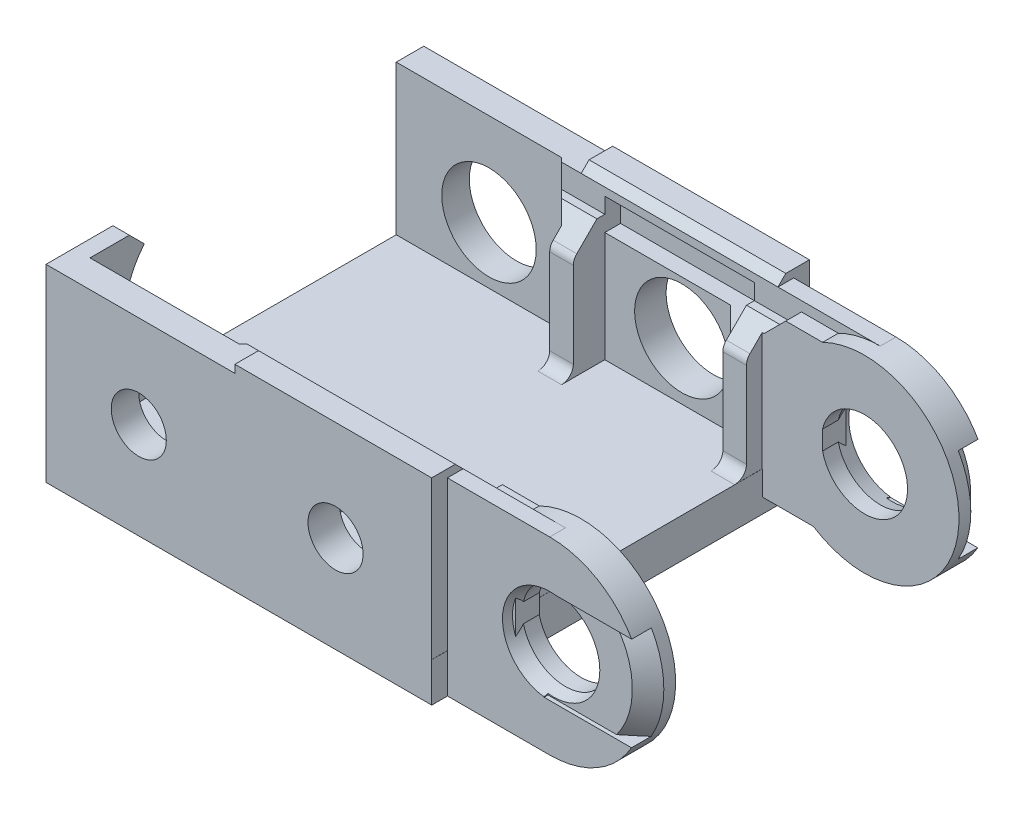
from build123d import *

# Parameters (mm, degrees)
SKETCH_1_W             = 25
SKETCH_1_H             = 25
EXTRUDE_1_DEPTH        = 4
SKETCH_2_W             = 24
SKETCH_2_H             = 24
EXTRUDE_2_DEPTH        = 3.5
EXTRUDE_4_DEPTH        = 2
SKETCH_6_R             = 5
CUT_EXTRUDE_2_DEPTH    = 10
EXTRUDE_6_DEPTH        = 20
SKETCH_9_W             = 19
SKETCH_9_H             = 3
CUT_EXTRUDE_4_DEPTH    = 2
CHAMFER_2_SIZE         = 1
CHAMFER_3_SIZE         = 3.732050808
CHAMFER_3_SIZE_2       = 1
CHAMFER_4_SIZE         = 1
SKETCH_11_W            = 3
SKETCH_11_H            = 4
EXTRUDE_7_DEPTH        = 16
PATTERN_LINEAR_1_COUNT = 2
PATTERN_LINEAR_1_PITCH = 22
CHAMFER_6_SIZE         = 3
FILLET_2_R             = 1.5
SKETCH_13_R            = 3.5
CUT_EXTRUDE_6_DEPTH    = 10
PATTERN_LINEAR_2_COUNT = 2
PATTERN_LINEAR_2_PITCH = 25
CHAMFER_7_SIZE         = 3
EXTRUDE_START          = 2
SKETCH_16_R            = 12
SKETCH_16_R_2          = 5.464101615
EXTRUDE_9_DEPTH        = 2
SKETCH_17_W            = 7.680831324
SKETCH_17_H            = 20.847988509
EXTRUDE_10_DEPTH       = 3
CHAMFER_8_SIZE         = 3
SKETCH_18_W            = 14.245473991
SKETCH_18_H            = 11.956484315
CUT_EXTRUDE_8_DEPTH    = 0.5
CHAMFER_9_SIZE         = 2
SKETCH_14_W            = 49.011527722
SKETCH_14_H            = 48
EXTRUDE_8_DEPTH        = 5
SKETCH_15_R            = 6
CUT_EXTRUDE_7_DEPTH    = 4
CHAMFER_10_SIZE        = 3
SKETCH_19_W            = 2.089122848
SKETCH_19_H            = 22.719512195
EXTRUDE_11_DEPTH       = 15
CHAMFER_11_SIZE        = 10
SKETCH_20_W            = 3.115975665
SKETCH_20_H            = 13.779759428
SKETCH_20_W_2          = 3.170504426
SKETCH_20_H_2          = 15.394986404
EXTRUDE_12_DEPTH       = 10
SKETCH_21_R            = 10.018007469
CUT_EXTRUDE_9_DEPTH    = 100


with BuildPart() as part:
    # Эскиз1 → Бобышка-Вытянуть1 (new body)
    with BuildSketch(Plane.XY):
        with Locations((-26.279531703, 11.219512195)):
            Rectangle(SKETCH_1_W, SKETCH_1_H)
    extrude(amount=EXTRUDE_1_DEPTH)

    # Эскиз2 → Бобышка-Вытянуть2 (add)
    with BuildSketch(Plane(origin=(0, 0, 0), x_dir=(-1, 0, 0), z_dir=(0, 0, -1))):
        with Locations((50.779531703, 10.719512195)):
            Rectangle(SKETCH_2_W, SKETCH_2_H)
    extrude(amount=-EXTRUDE_2_DEPTH)

    # Эскиз5 → Бобышка-Вытянуть4 (add)
    with BuildSketch(Plane.XY.offset(4)):
        with BuildLine():
            Line((-18.981970926, 22.719512195), (-0.779531703, 22.719512195))
            ThreePointArc((-0.779531703, 22.719512195), (11.220468297, 10.719512195), (-0.779531703, -1.280487805))
            Line((-0.779531703, -1.280487805), (-18.981970926, -1.280487805))
            ThreePointArc((-18.981970926, -1.280487805), (-30.981970926, 10.719512195), (-18.981970926, 22.719512195))
        make_face()
    extrude(amount=-EXTRUDE_4_DEPTH)

    # Эскиз6 → Вырез-Вытянуть2 (cut)
    with BuildSketch(Plane(origin=(0, 0, 2), x_dir=(-1, 0, 0), z_dir=(0, 0, -1))):
        with Locations((0.779531703, 10.719512195)):
            Circle(SKETCH_6_R)
    extrude(amount=-CUT_EXTRUDE_2_DEPTH, mode=Mode.SUBTRACT)

    # Эскиз8 → Бобышка-Вытянуть6 (add)
    with BuildSketch(Plane.XY.offset(4)):
        Polygon((-38.779531703, 3.719512195), (-35.779531703, 3.719512195), (-35.779531703, 0.719512195), (-16.779531703, 0.719512195), (-16.779531703, 3.719512195), (-13.779531703, 3.719512195), (-13.779531703, -1.280487805), (-38.779531703, -1.280487805), align=None)
    extrude(amount=EXTRUDE_6_DEPTH)

    # Эскиз9 → Вырез-Вытянуть4 (cut)
    with BuildSketch(Plane.XY.offset(4)):
        with Locations((-26.279531703, 19.219512195)):
            Rectangle(SKETCH_9_W, SKETCH_9_H)
    extrude(amount=-CUT_EXTRUDE_4_DEPTH, mode=Mode.SUBTRACT)

    # Фаска2
    chamfer_2_edges = [part.edges().sort_by_distance(p)[0] for p in [
        (-26.279531703, 20.719512195, 4),
    ]]
    chamfer(chamfer_2_edges, length=CHAMFER_2_SIZE)

    # Фаска3
    # the kernel refuses this chamfer: 3.732050808, 1 mm, written as the material it takes off along each edge
    with BuildSketch(Plane(origin=(-0.779531703, 10.719512195, 2), x_dir=(-1, 0, 0), z_dir=(0, -1, 0))) as chamfer_3_piece_1:
        Polygon((5, -CHAMFER_3_SIZE), (5 + CHAMFER_3_SIZE_2, 0), (5, 0), align=None)
    revolve(axis=Axis((-0.779531703, 10.719512195, 2), (0, 0, -1)), mode=Mode.SUBTRACT)

    # Фаска4
    chamfer_4_edges = [part.edges().sort_by_distance(p)[0] for p in [
        (-26.279531703, 23.719512195, 4),
    ]]
    chamfer(chamfer_4_edges, length=CHAMFER_4_SIZE)

    # Эскиз11 → Бобышка-Вытянуть7 (add)
    with BuildSketch(Plane(origin=(0, 3.719512195, 0), x_dir=(1, 0, 0), z_dir=(0, 1, 0))):
        with Locations((-37.279531703, -6)):
            Rectangle(SKETCH_11_W, SKETCH_11_H)
    extrude_7 = extrude(amount=EXTRUDE_7_DEPTH)

    # Линейный массив1: Бобышка-Вытянуть7 ×2
    with Locations(*[(i * PATTERN_LINEAR_1_PITCH, 0, 0) for i in range(1, PATTERN_LINEAR_1_COUNT)]):
        add(extrude_7)

    # Фаска6
    chamfer_6_edges = [part.edges().sort_by_distance(p)[0] for p in [
        (-37.279531703, 19.719512195, 8),
        (-15.279531703, 19.719512195, 8),
    ]]
    chamfer(chamfer_6_edges, length=CHAMFER_6_SIZE)

    # Скругление2
    fillet_2_edges = [part.edges().sort_by_distance(p)[0] for p in [
        (-37.279531703, 3.719512195, 8),
        (-15.279531703, 3.719512195, 8),
        (-15.279531703, 16.719512195, 8),
        (-37.279531703, 16.719512195, 8),
    ]]
    fillet(fillet_2_edges, radius=FILLET_2_R)

    # Эскиз13 → Вырез-Вытянуть6 (cut)
    with BuildSketch(Plane.XY.offset(4)):
        with Locations((-50.99297436, 10.976933739)):
            Circle(SKETCH_13_R)
    cut_extrude_6 = extrude(amount=-CUT_EXTRUDE_6_DEPTH, mode=Mode.SUBTRACT)

    # Линейный массив2: Вырез-Вытянуть6 ×2
    with Locations(*[(i * PATTERN_LINEAR_2_PITCH, 0, 0) for i in range(1, PATTERN_LINEAR_2_COUNT)]):
        add(cut_extrude_6, mode=Mode.SUBTRACT)

    # Фаска7
    # the kernel refuses this chamfer: 3 mm, written as the material it adds along each edge
    with BuildSketch(Plane(origin=(-38.779531703, -1.280487805, 3.5), x_dir=(0.027495876610586775, 0, 0.9996219169112968), z_dir=(0, 1, 0))) as chamfer_7_piece_1_section:
        Polygon((CHAMFER_7_SIZE * 0.999621916911, -CHAMFER_7_SIZE * 0.0274958766106), (-CHAMFER_7_SIZE * 0.0274958766106, -CHAMFER_7_SIZE * 0.999621916911), (0, 0), align=None)
    chamfer_7_piece_1 = extrude(amount=24, mode=Mode.PRIVATE)
    chamfer_7_piece_1 = split(chamfer_7_piece_1, bisect_by=Plane(origin=(-39.565507371, 14.486080369, 10.233431826), z_dir=(0, -0.7071067811865476, -0.7071067811865476)), keep=Keep.TOP, mode=Mode.PRIVATE)
    chamfer_7_piece_1 = split(chamfer_7_piece_1, bisect_by=Plane(origin=(-39.565507371, 19.719512195, 4.865584532), z_dir=(0, -1, 0)), keep=Keep.TOP, mode=Mode.PRIVATE)
    chamfer_7_piece_1 = split(chamfer_7_piece_1, bisect_by=Plane(origin=(-39.565507371, 9.118233075, 4), z_dir=(0, 0, 1)), keep=Keep.TOP, mode=Mode.PRIVATE)
    add(chamfer_7_piece_1)
    with BuildSketch(Plane(origin=(-38.779531703, -1.280487805, 3.5), x_dir=(0.027495876610586775, 0, 0.9996219169112968), z_dir=(0, 1, 0))) as chamfer_7_piece_2_section:
        Polygon((CHAMFER_7_SIZE * 0.999621916911, -CHAMFER_7_SIZE * 0.0274958766106), (-CHAMFER_7_SIZE * 0.0274958766106, -CHAMFER_7_SIZE * 0.999621916911), (0, 0), align=None)
    chamfer_7_piece_2 = extrude(amount=24, mode=Mode.PRIVATE)
    chamfer_7_piece_2 = split(chamfer_7_piece_2, bisect_by=Plane(origin=(-40.193745069, 19.719512195, 3.702787563), z_dir=(0, -1, 0)), keep=Keep.TOP, mode=Mode.PRIVATE)
    chamfer_7_piece_2 = split(chamfer_7_piece_2, bisect_by=Plane(origin=(-40.193745069, 9.219512195, 4), z_dir=(0, 0, -1)), keep=Keep.TOP, mode=Mode.PRIVATE)
    add(chamfer_7_piece_2)
    with BuildSketch(Plane(origin=(-38.779531703, -1.280487805, 3.5), x_dir=(0.027495876610586775, 0, 0.9996219169112968), z_dir=(0, 1, 0))) as chamfer_7_piece_3_section:
        Polygon((CHAMFER_7_SIZE * 0.999621916911, -CHAMFER_7_SIZE * 0.0274958766106), (-CHAMFER_7_SIZE * 0.0274958766106, -CHAMFER_7_SIZE * 0.999621916911), (0, 0), align=None)
    chamfer_7_piece_3 = extrude(amount=24, mode=Mode.PRIVATE)
    chamfer_7_piece_3 = split(chamfer_7_piece_3, bisect_by=Plane(origin=(-40.213814106, 20.708451484, 4.011060711), z_dir=(0, -0.7071067811865476, -0.7071067811865476)), keep=Keep.TOP, mode=Mode.PRIVATE)
    chamfer_7_piece_3 = split(chamfer_7_piece_3, bisect_by=Plane(origin=(-40.213814106, 19.719512195, 3.681414282), z_dir=(0, 1, 0)), keep=Keep.TOP, mode=Mode.PRIVATE)
    chamfer_7_piece_3 = split(chamfer_7_piece_3, bisect_by=Plane(origin=(-40.213814106, 20.378805054, 4), z_dir=(0, 0, -1)), keep=Keep.TOP, mode=Mode.PRIVATE)
    add(chamfer_7_piece_3)
    with BuildSketch(Plane(origin=(-38.779531703, -1.280487805, 3.5), x_dir=(0.027495876610586775, 0, 0.9996219169112968), z_dir=(0, 1, 0))) as chamfer_7_piece_4_section:
        Polygon((CHAMFER_7_SIZE * 0.999621916911, -CHAMFER_7_SIZE * 0.0274958766106), (-CHAMFER_7_SIZE * 0.0274958766106, -CHAMFER_7_SIZE * 0.999621916911), (0, 0), align=None)
    chamfer_7_piece_4 = extrude(amount=24, mode=Mode.PRIVATE)
    chamfer_7_piece_4 = split(chamfer_7_piece_4, bisect_by=Plane(origin=(-40.178456137, 21.430209627, 3.289302568), z_dir=(0, 0.7071067811865476, 0.7071067811865476)), keep=Keep.TOP, mode=Mode.PRIVATE)
    chamfer_7_piece_4 = split(chamfer_7_piece_4, bisect_by=Plane(origin=(-40.178456137, 21.85997715, 4), z_dir=(0, 0, -1)), keep=Keep.TOP, mode=Mode.PRIVATE)
    add(chamfer_7_piece_4)
    with BuildSketch(Plane(origin=(-16.779531703, 17.719512195, 4), x_dir=(-0.9996219169112968, 0, -0.027495876610586334), z_dir=(0, -1, 0))) as chamfer_7_piece_5:
        Polygon((CHAMFER_7_SIZE * 0.999621916911, -CHAMFER_7_SIZE * 0.0274958766106), (-CHAMFER_7_SIZE * 0.0274958766106, -CHAMFER_7_SIZE * 0.999621916911), (0, 0), align=None)
    extrude(amount=17)

    # Эскиз16 → Бобышка-Вытянуть9 (add)
    with BuildSketch(Plane.XY.offset(4).offset(EXTRUDE_START)):
        with Locations((-0.779531703, 10.719512195)):
            Circle(SKETCH_16_R)
        with Locations((-0.779531703, 10.719512195)):
            Circle(SKETCH_16_R_2, mode=Mode.SUBTRACT)
    extrude(amount=-EXTRUDE_9_DEPTH)

    # Эскиз17 → Бобышка-Вытянуть10 (add)
    with BuildSketch(Plane.XY.offset(6)):
        with Locations((-9.948822286, 11.047405779)):
            Rectangle(SKETCH_17_W, SKETCH_17_H)
    extrude(amount=-EXTRUDE_10_DEPTH)

    # Фаска8
    # the kernel refuses this chamfer: 3 mm, written as the material it takes off along each edge
    with BuildSketch(Plane(origin=(-13.789237948, 21.471400033, 13.715048964), x_dir=(-0.02749587661058619, -0.9996219169112968, 0), z_dir=(0, 0, -1))) as chamfer_8_piece_1_section:
        Polygon((CHAMFER_8_SIZE * 0.999621916911, -CHAMFER_8_SIZE * 0.0274958766106), (-CHAMFER_8_SIZE * 0.0274958766106, -CHAMFER_8_SIZE * 0.999621916911), (0, 0), align=None)
    chamfer_8_piece_1 = extrude(amount=9.715048964, mode=Mode.PRIVATE)
    chamfer_8_piece_1 = split(chamfer_8_piece_1, bisect_by=Plane(origin=(-13.43362751, 19.719512195, 9.582125012), z_dir=(0, -1, 0)), keep=Keep.TOP, mode=Mode.PRIVATE)
    chamfer_8_piece_1 = split(chamfer_8_piece_1, bisect_by=Plane(origin=(-13.43362751, 17.203849158, 7.515663037), z_dir=(0, 0.7071067811865476, 0.7071067811865476)), keep=Keep.TOP, mode=Mode.PRIVATE)
    add(chamfer_8_piece_1, mode=Mode.SUBTRACT)
    with BuildSketch(Plane(origin=(-13.789237948, 21.471400033, 13.715048964), x_dir=(-0.02749587661058619, -0.9996219169112968, 0), z_dir=(0, 0, -1))) as chamfer_8_piece_2_section:
        Polygon((CHAMFER_8_SIZE * 0.999621916911, -CHAMFER_8_SIZE * 0.0274958766106), (-CHAMFER_8_SIZE * 0.0274958766106, -CHAMFER_8_SIZE * 0.999621916911), (0, 0), align=None)
    chamfer_8_piece_2 = extrude(amount=9.715048964, mode=Mode.PRIVATE)
    chamfer_8_piece_2 = split(chamfer_8_piece_2, bisect_by=Plane(origin=(-12.648248864, 19.719512195, 8.954303846), z_dir=(0, 1, 0)), keep=Keep.TOP, mode=Mode.PRIVATE)
    chamfer_8_piece_2 = split(chamfer_8_piece_2, bisect_by=Plane(origin=(-12.648248864, 18.268459592, 6.451052603), z_dir=(0, 0.7071067811865476, 0.7071067811865476)), keep=Keep.TOP, mode=Mode.PRIVATE)
    add(chamfer_8_piece_2, mode=Mode.SUBTRACT)
    with BuildSketch(Plane(origin=(-13.789237948, 21.471400033, 13.715048964), x_dir=(-0.02749587661058619, -0.9996219169112968, 0), z_dir=(0, 0, -1))) as chamfer_8_piece_3_section:
        Polygon((CHAMFER_8_SIZE * 0.999621916911, -CHAMFER_8_SIZE * 0.0274958766106), (-CHAMFER_8_SIZE * 0.0274958766106, -CHAMFER_8_SIZE * 0.999621916911), (0, 0), align=None)
    chamfer_8_piece_3 = extrude(amount=9.715048964, mode=Mode.PRIVATE)
    chamfer_8_piece_3 = split(chamfer_8_piece_3, bisect_by=Plane(origin=(-13.010508366, 19.719512195, 4.316738871), z_dir=(0, 1, 0)), keep=Keep.TOP, mode=Mode.PRIVATE)
    chamfer_8_piece_3 = split(chamfer_8_piece_3, bisect_by=Plane(origin=(-13.010508366, 20.244403888, 4.475108307), z_dir=(0, -0.7071067811865476, -0.7071067811865476)), keep=Keep.TOP, mode=Mode.PRIVATE)
    add(chamfer_8_piece_3, mode=Mode.SUBTRACT)

    # Эскиз18 → Вырез-Вытянуть8 (cut)
    with BuildSketch(Plane(origin=(0, 0, 2), x_dir=(-1, 0, 0), z_dir=(0, 0, -1))):
        with Locations((-5.621890795, 10.697754353)):
            Rectangle(SKETCH_18_W, SKETCH_18_H)
    extrude(amount=-CUT_EXTRUDE_8_DEPTH, mode=Mode.SUBTRACT)

    # Фаска9
    chamfer_9_edges = [part.edges().sort_by_distance(p)[0] for p in [
        (11.22044206, 10.694418644, 2.5),
    ]]
    chamfer(chamfer_9_edges, length=CHAMFER_9_SIZE)

    # Зеркальное отражение1: part across plane


with BuildPart() as part_1:
    add(part.part)
    add(part.part.mirror(Plane(origin=(0, 0, 24), x_dir=(1, 0, 0), z_dir=(0, 0, -1))))

    # Эскиз14 → Бобышка-Вытянуть8 (add)
    with BuildSketch(Plane(origin=(0, -1.280487805, 0), x_dir=(-1, 0, 0), z_dir=(0, -1, 0))):
        with Locations((38.273767842, -24)):
            Rectangle(SKETCH_14_W, SKETCH_14_H)
    extrude(amount=-EXTRUDE_8_DEPTH)

    # Эскиз15 → Вырез-Вытянуть7 (cut)
    with BuildSketch(Plane(origin=(0, 0, 0), x_dir=(-1, 0, 0), z_dir=(0, 0, -1))):
        with Locations((50.99297436, 10.976933739)):
            Circle(SKETCH_15_R)
        with Locations((25.99297436, 10.976933739)):
            Circle(SKETCH_15_R)
    extrude(amount=-CUT_EXTRUDE_7_DEPTH, mode=Mode.SUBTRACT)

    # Фаска10
    chamfer_10_edges = [part_1.edges().sort_by_distance(p)[0] for p in [
        (-27.779531703, 3.719512195, 44),
        (-52.279531703, 3.719512195, 44.5),
    ]]
    chamfer(chamfer_10_edges, length=CHAMFER_10_SIZE)

    # Эскиз19 → Бобышка-Вытянуть11 (add)
    with BuildSketch(Plane(origin=(0, 0, 44.5), x_dir=(-1, 0, 0), z_dir=(0, 0, -1))):
        with Locations((61.734970279, 11.359756098)):
            Rectangle(SKETCH_19_W, SKETCH_19_H)
    extrude(amount=EXTRUDE_11_DEPTH)

    # Фаска11
    chamfer_11_edges = [part_1.edges().sort_by_distance(p)[0] for p in [
        (-61.734970279, 22.719512195, 29.5),
    ]]
    chamfer(chamfer_11_edges, length=CHAMFER_11_SIZE)

    # Эскиз20 → Бобышка-Вытянуть12 (add)
    with BuildSketch(Plane(origin=(0, 0, 40), x_dir=(-1, 0, 0), z_dir=(0, 0, -1))):
        with Locations((15.337519536, 9.208312138)):
            Rectangle(SKETCH_20_W, SKETCH_20_H)
        with Locations((37.364783916, 8.40069865)):
            Rectangle(SKETCH_20_W_2, SKETCH_20_H_2)
    extrude(amount=EXTRUDE_12_DEPTH)

    # Эскиз21 → Вырез-Вытянуть9 (cut)
    with BuildSketch(Plane(origin=(-13.779531703, 0, 0), x_dir=(0, 0, -1), z_dir=(1, 0, 0))):
        with Locations((-30, 14.280557352)):
            Circle(SKETCH_21_R)
    extrude(amount=-CUT_EXTRUDE_9_DEPTH, mode=Mode.SUBTRACT)


solid = part_1.part
